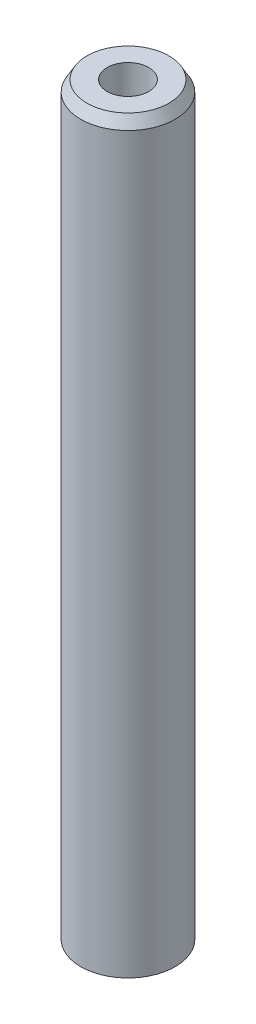
from build123d import *
from OCP.BRepFilletAPI import BRepFilletAPI_MakeChamfer

# Parameters (mm, degrees)
SKETCH1_R           = 20
BOSS_EXTRUDE1_DEPTH = 317.721940365
SKETCH2_R           = 8.807917795
CUT_EXTRUDE1_DEPTH  = 319.978418375
CHAMFER1_SIZE       = 4.574036778
CHAMFER1_SIZE2      = 2.640821365


with BuildPart() as part:
    # Sketch1 → Boss-Extrude1 (new body)
    with BuildSketch(Plane(origin=(0, 0, 0), x_dir=(1, 0, 0), z_dir=(0, 1, 0))):
        Circle(SKETCH1_R)
    extrude(amount=BOSS_EXTRUDE1_DEPTH)

    # Sketch2 → Cut-Extrude1 (cut, through all)
    with BuildSketch(Plane(origin=(0, 0, 0), x_dir=(1, 0, 0), z_dir=(0, 1, 0))):
        Circle(SKETCH2_R)
    extrude(amount=CUT_EXTRUDE1_DEPTH, mode=Mode.SUBTRACT)

    # Chamfer1: one chamfer whose edges measure the first distance from different faces: ONE call of the kernel's chamfer builder (chamfer() names one face for all edges)
    chamfer1_edges_1 = [part.edges().sort_by_distance(p)[0] for p in [
        (-20, 317.721940365, 0),
    ]]
    chamfer1_side_1 = [part.faces().sort_by_distance(p)[0] for p in [
        (-20, 158.860970182, 0),
    ]]
    chamfer1_edges_2 = [part.edges().sort_by_distance(p)[0] for p in [
        (-20, 0, 0),
    ]]
    chamfer1_side_2 = [part.faces().sort_by_distance(p)[0] for p in [
        (-19.434314575, 0, 0),
    ]]
    chamfer1 = BRepFilletAPI_MakeChamfer(part.part.solid().wrapped)
    for e in chamfer1_edges_1:
        chamfer1.Add(CHAMFER1_SIZE, CHAMFER1_SIZE2, e.wrapped, chamfer1_side_1[0].wrapped)  # the first distance lies on this face
    for e in chamfer1_edges_2:
        chamfer1.Add(CHAMFER1_SIZE, CHAMFER1_SIZE2, e.wrapped, chamfer1_side_2[0].wrapped)  # the first distance lies on this face
    add(Compound.cast(chamfer1.Shape()), mode=Mode.REPLACE)


solid = part.part
